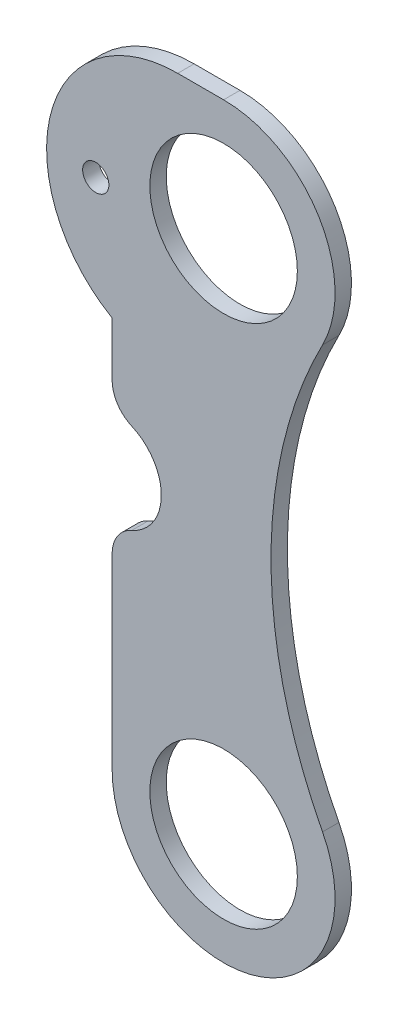
from build123d import *

# Parameters (mm, degrees)
SKETCH1_R           = 14.2875
SKETCH1_R_2         = 2.54
BOSS_EXTRUDE1_DEPTH = 3.175
CUT_EXTRUDE1_DEPTH  = 162.674043733
FILLET3_R           = 6.35
SKETCH3_R           = 2.54
BOSS_EXTRUDE3_DEPTH = 3.175
SKETCH6_R           = 2.54
BOSS_EXTRUDE4_DEPTH = 3.175
FILLET2_R           = 6.35
CUT_EXTRUDE2_DEPTH  = 169.237022961
CUT_EXTRUDE3_DEPTH  = 169.237022961
CUT_EXTRUDE4_DEPTH  = 168.265702461
SKETCH15_R          = 2.54
BOSS_EXTRUDE8_DEPTH = 3.175


with BuildPart() as part:
    # Sketch1 → Boss-Extrude1 (new body)
    with BuildSketch(Plane.XY):
        with BuildLine():
            Line((-8.89, 25.4), (8.89, 25.4))
            ThreePointArc((8.89, 25.4), (17.870256121, 21.680256121), (21.59, 12.7))
            Line((21.59, 12.7), (21.59, -117.775079775))
            ThreePointArc((21.59, -117.775079775), (21.127743647, -120.388718212), (19.797058824, -122.685251408))
            Line((19.797058824, -122.685251408), (-7.952696208, -155.616779465))
            ThreePointArc((-7.952696208, -155.616779465), (-12.268297602, -157.851943494), (-16.900388255, -156.380852124))
            Line((-16.900388255, -156.380852124), (-32.439211784, -143.287061102))
            ThreePointArc((-32.439211784, -143.287061102), (-34.674375812, -138.971459708), (-33.203284443, -134.339369055))
            Line((-33.203284443, -134.339369055), (-23.382941176, -122.685251408))
            ThreePointArc((-23.382941176, -122.685251408), (-22.052256353, -120.388718212), (-21.59, -117.775079775))
            Line((-21.59, -117.775079775), (-21.59, 12.7))
            ThreePointArc((-21.59, 12.7), (-17.870256121, 21.680256121), (-8.89, 25.4))
        make_face()
        Circle(SKETCH1_R, mode=Mode.SUBTRACT)
        with Locations((0, -101.6)):
            Circle(SKETCH1_R, mode=Mode.SUBTRACT)
        with Locations((-18.532085478, -142.550133084)):
            Circle(SKETCH1_R_2, mode=Mode.SUBTRACT)
    extrude(amount=BOSS_EXTRUDE1_DEPTH)

    # Sketch2 → Cut-Extrude1 (cut, through all)
    with BuildSketch(Plane.XY):
        with BuildLine():
            ThreePointArc((-21.59, -60.325), (-12.065, -50.8), (-21.59, -41.275))
            Line((-21.59, -41.275), (-21.59, -60.325))
        make_face()
        with BuildLine():
            ThreePointArc((19.159083004, -91.647229609), (21.458203844, -103.981929422), (16.51, -115.512152961))
            Line((16.51, -115.512152961), (-17.501317584, -155.874478972))
            Line((-17.501317584, -155.874478972), (-7.620284479, -163.8572221))
            Line((-7.620284479, -163.8572221), (27.94, -121.656687185))
            Line((27.94, -121.656687185), (27.94, 0))
            Line((27.94, 0), (21.59, 0))
            ThreePointArc((21.59, 0), (20.973467787, -5.122670102), (19.159083004, -9.952770391))
            ThreePointArc((19.159083004, -9.952770391), (9.182340769, -50.8), (19.159083004, -91.647229609))
        make_face()
    extrude(amount=CUT_EXTRUDE1_DEPTH, mode=Mode.SUBTRACT)


with BuildPart() as cut_extrude1_piece_1:
    # of the separate pieces the step leaves, piece 1, a body of its own (cut_extrude1_pieces)
    add(part.part.solids().sort_by_distance((-8.89, 25.4, 0))[0])

    # Fillet3
    fillet3_edges = [cut_extrude1_piece_1.edges().sort_by_distance(p)[0] for p in [
        (-21.59, -41.275, 1.5875),
        (-21.59, -60.325, 1.5875),
    ]]
    fillet(fillet3_edges, radius=FILLET3_R)

    # Sketch3 → Boss-Extrude3 (add)
    with BuildSketch(Plane.XY.offset(3.175)):
        with BuildLine():
            Line((-27.351416194, -127.394768527), (-36.025496499, -137.688579))
            ThreePointArc((-36.025496499, -137.688579), (-37.217489152, -141.441859142), (-35.4063854, -144.93869507))
            Line((-35.4063854, -144.93869507), (-24.403104784, -154.210610454))
            ThreePointArc((-24.403104784, -154.210610454), (-19.771014132, -155.681701823), (-15.455412737, -153.446537795))
            Line((-15.455412737, -153.446537795), (-7.557639641, -144.073996091))
            Line((-7.557639641, -144.073996091), (-27.351416194, -127.394768527))
        make_face()
        with Locations((-18.532085478, -142.550133084)):
            Circle(SKETCH3_R, mode=Mode.SUBTRACT)
    extrude(amount=-BOSS_EXTRUDE3_DEPTH)

    # Sketch6 → Boss-Extrude4 (add)
    with BuildSketch(Plane.XY.offset(3.175)):
        Polygon((-35.4063854, -144.93869507), (-63.620410749, -121.164144113), (-51.344981666, -106.596497054), (-27.065569901, -127.055545526), align=None)
        with Locations((-52.626813855, -117.972130278)):
            Circle(SKETCH6_R, mode=Mode.SUBTRACT)
    extrude(amount=-BOSS_EXTRUDE4_DEPTH)

    # Fillet2
    fillet2_edges = [cut_extrude1_piece_1.edges().sort_by_distance(p)[0] for p in [
        (-63.620410749, -121.164144113, 1.5875),
        (-51.344981666, -106.596497054, 1.5875),
        (-27.065569901, -127.055545526, 1.5875),
    ]]
    fillet(fillet2_edges, radius=FILLET2_R)

    # Sketch7 → Cut-Extrude2 (cut, through all)
    with BuildSketch(Plane.XY.offset(3.175)):
        with BuildLine():
            Line((-21.59, 0), (-21.59, 31.75))
            Line((-21.59, 31.75), (21.59, 31.75))
            Line((21.59, 31.75), (21.59, 0))
            ThreePointArc((21.59, 0), (0, 21.59), (-21.59, 0))
        make_face()
    extrude(amount=-CUT_EXTRUDE2_DEPTH, mode=Mode.SUBTRACT)


with BuildPart() as cut_extrude1_piece_2:
    # of the separate pieces the step leaves, piece 2, a body of its own (cut_extrude1_pieces)
    add(part.part.solids().sort_by_distance((-16.900388255, -156.380852124, 0))[0])


with BuildPart() as cut_extrude3_tool:
    # Sketch10 → Cut-Extrude3 (new, through all)
    with BuildSketch(Plane.XY.offset(3.175)):
        with BuildLine():
            Line((-18.151882461, -155.32628042), (-17.361482582, -157.512020269))
            Line((-17.361482582, -157.512020269), (-14.375706423, -156.432313955))
            Line((-14.375706423, -156.432313955), (-15.455412737, -153.446537795))
            ThreePointArc((-15.455412737, -153.446537795), (-16.679911193, -154.563907595), (-18.151882461, -155.32628042))
        make_face()
    extrude(amount=-CUT_EXTRUDE3_DEPTH)


with BuildPart() as cut_extrude1_piece_1_1:
    add(cut_extrude1_piece_1.part)

    # Cut-Extrude3: cut by cut_extrude3_tool
    add(cut_extrude3_tool.part, mode=Mode.SUBTRACT)

    # Sketch12 → Cut-Extrude4 (cut, through all)
    with BuildSketch(Plane.XY.offset(3.175)):
        with BuildLine():
            Line((-21.59, -101.6), (-72.39, -101.6))
            Line((-72.39, -101.6), (-72.39, -165.1))
            Line((-72.39, -165.1), (16.51, -165.1))
            Line((16.51, -165.1), (16.51, -115.512152961))
            ThreePointArc((16.51, -115.512152961), (-7.405308906, -121.880273667), (-21.59, -101.6))
        make_face()
    extrude(amount=-CUT_EXTRUDE4_DEPTH, mode=Mode.SUBTRACT)

    # Sketch15 → Boss-Extrude8 (add)
    with BuildSketch(Plane.XY.offset(3.175)):
        with BuildLine():
            ThreePointArc((-34.29, -3.81), (-30.887045256, -16.51), (-21.59, -25.807045256))
            Line((-21.59, -25.807045256), (-21.59, 0))
            ThreePointArc((-21.59, 0), (-15.266435406, 15.266435406), (0, 21.59))
            Line((0, 21.59), (-8.89, 21.59))
            ThreePointArc((-8.89, 21.59), (-26.850512242, 14.150512242), (-34.29, -3.81))
        make_face()
        with Locations((-24.765, -3.81)):
            Circle(SKETCH15_R, mode=Mode.SUBTRACT)
    extrude(amount=-BOSS_EXTRUDE8_DEPTH)


with BuildPart() as cut_extrude1_piece_2_1:
    add(cut_extrude1_piece_2.part)

    # Cut-Extrude3: cut by cut_extrude3_tool
    add(cut_extrude3_tool.part, mode=Mode.SUBTRACT)


solid = cut_extrude1_piece_1_1.part
